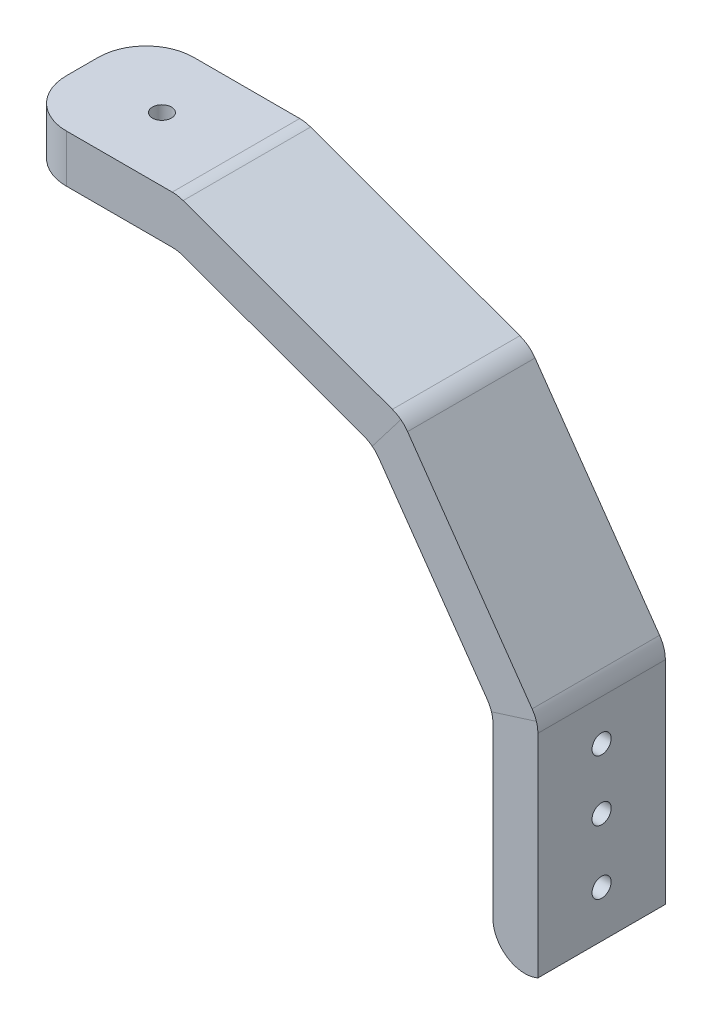
from build123d import *

# Parameters (mm, degrees)
SKETCH1_W           = 50
SKETCH1_H           = 40
SKETCH1_R           = 3
BOSS_EXTRUDE1_DEPTH = 15
SWEEP1_START        = -20
SWEEP1_DEPTH        = 40
FILLET1_R           = 15
SKETCH3_R           = 3
CUT_EXTRUDE1_DEPTH  = 220.951933549
FILLET2_R           = 10


# Read off the part's stored shape, not the designer's step: Sweep1
with BuildPart() as part:
    # Sketch1 → Boss-Extrude1 (new body)
    with BuildSketch(Plane(origin=(0, 0, 0), x_dir=(1, 0, 0), z_dir=(0, 1, 0))):
        Rectangle(SKETCH1_W, SKETCH1_H)
        with Locations(Location((0, 0, 0), (0, 0, 270))):
            Circle(SKETCH1_R, mode=Mode.SUBTRACT)
    extrude(amount=BOSS_EXTRUDE1_DEPTH)

    # Sweep1 outline → Sweep1 (add)
    with BuildSketch(Plane.XY.offset(SWEEP1_START)):
        Polygon((123.881139344, -76.004182722), (123.881139344, -146.347204208), (137.976528655, -141.216902058), (137.976528655, -71.559923544), (95.277055769, -10.578756452), (25, 15), (25, 0), (86.279911141, -22.304063614), align=None)
    extrude(amount=SWEEP1_DEPTH)

    # Fillet1
    fillet1_edges = [part.edges().sort_by_distance(p)[0] for p in [
        (-25, 7.5, 20),
        (-25, 7.5, -20),
    ]]
    fillet(fillet1_edges, radius=FILLET1_R)

    # Sketch3 → Cut-Extrude1 (cut, through all)
    with BuildSketch(Plane(origin=(137.976528655, 0, 0), x_dir=(0, 0, -1), z_dir=(1, 0, 0))):
        with Locations(Location((0, -106.559923544, 0), (0, 0, 90))):
            Circle(SKETCH3_R)
        with Locations(Location((0, -87.559923544, 0), (0, 0, 90))):
            Circle(SKETCH3_R)
        with Locations(Location((0, -126.559923544, 0), (0, 0, 90))):
            Circle(SKETCH3_R)
    extrude(amount=-CUT_EXTRUDE1_DEPTH, mode=Mode.SUBTRACT)

    # Fillet2
    fillet2_edges = [part.edges().sort_by_distance(p)[0] for p in [
        (123.881139344, -146.347204208, 0),
        (137.976528655, -71.559923544, 0),
        (123.881139344, -76.004182722, 0),
        (95.277055769, -10.578756452, 0),
        (86.279911141, -22.304063614, 0),
        (25, 15, 0),
        (25, 0, 0),
    ]]
    fillet(fillet2_edges, radius=FILLET2_R)


solid = part.part
